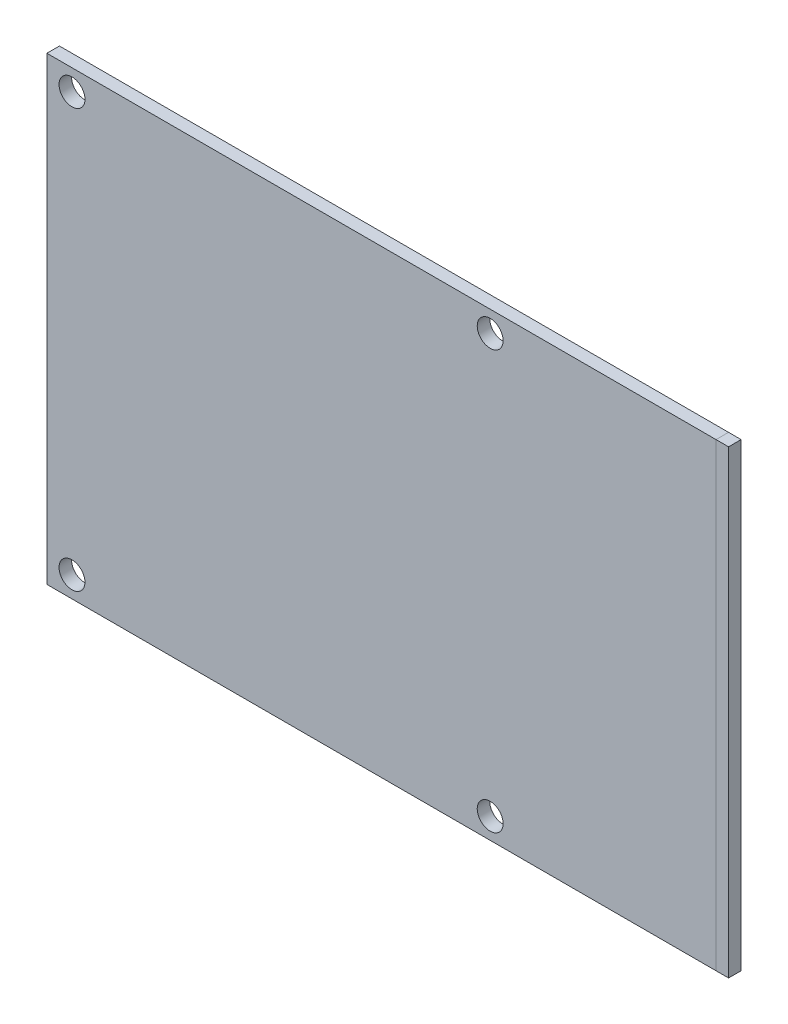
from build123d import *

# Parameters (mm, degrees)
SKETCH_1_W          = 80
SKETCH_1_H          = 55
EXTRUDE_1_DEPTH     = 1.5
SKETCH_2_R          = 1.55
CUT_EXTRUDE_1_DEPTH = 1.5
SKETCH_3_W          = 1.5
SKETCH_3_H          = 55
EXTRUDE_2_DEPTH     = 1.5


with BuildPart() as part:
    # 草图1 → 凸台-拉伸1 (new body)
    with BuildSketch(Plane.XY):
        Rectangle(SKETCH_1_W, SKETCH_1_H)
    extrude(amount=EXTRUDE_1_DEPTH)

    # 草图2 → 切除-拉伸1 (cut)
    with BuildSketch(Plane(origin=(0, 0, 0), x_dir=(-1, 0, 0), z_dir=(0, 0, -1))):
        with Locations((37, 25)):
            Circle(SKETCH_2_R)
        with Locations((37, -25)):
            Circle(SKETCH_2_R)
        with Locations((-13, 25)):
            Circle(SKETCH_2_R)
        with Locations((-13, -25)):
            Circle(SKETCH_2_R)
    extrude(amount=-CUT_EXTRUDE_1_DEPTH, mode=Mode.SUBTRACT)


with BuildPart() as body_2:
    # 草图3 → 凸台-拉伸2 (new body)
    with BuildSketch(Plane(origin=(40, 0, 0), x_dir=(0, 0, -1), z_dir=(1, 0, 0))):
        with Locations((-0.75, 0)):
            Rectangle(SKETCH_3_W, SKETCH_3_H)
    extrude(amount=EXTRUDE_2_DEPTH)


solid = Compound([part.part, body_2.part])
